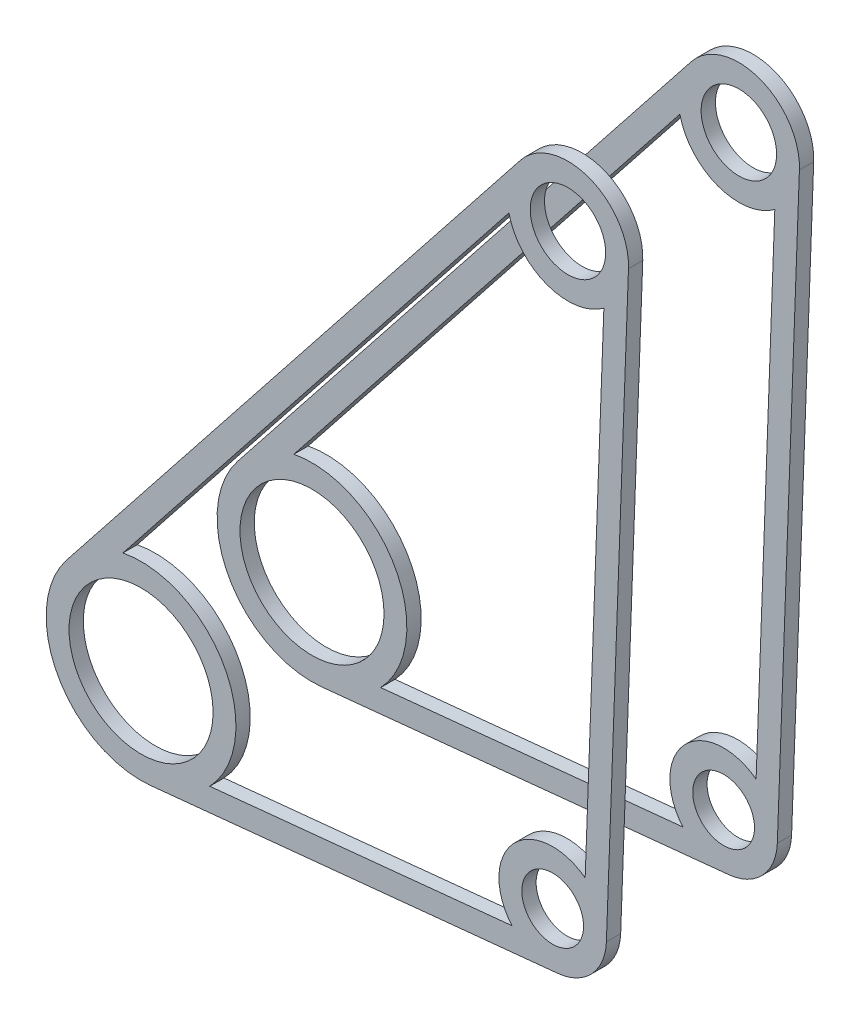
from build123d import *

# Parameters (mm, degrees)
BOSS_EXTRUDE1_START = 8.6995
SKETCH1_R           = 8.001
SKETCH1_R_2         = 4.191
SKETCH1_R_3         = 3.429
BOSS_EXTRUDE1_DEPTH = 1.5875
BOSS_EXTRUDE2_START = -8.6995
SKETCH1_4_R         = 8.001
SKETCH1_4_R_2       = 4.191
SKETCH1_4_R_3       = 3.429
BOSS_EXTRUDE2_DEPTH = 1.5875


with BuildPart() as part:
    # Sketch1 → Boss-Extrude1 (new body)
    with BuildSketch(Plane.XY.offset(BOSS_EXTRUDE1_START)):
        with BuildLine():
            ThreePointArc((-8.264104742, 6.543489422), (-9.247450164, -5.059382025), (1.0541, -10.488162575))
            Line((1.0541, -10.488162575), (46.3169, -5.939080012))
            ThreePointArc((46.3169, -5.939080012), (50.071526337, -4.085728764), (51.684874278, -0.221891526))
            Line((51.684874278, -0.221891526), (54.139680923, 65.768068925))
            ThreePointArc((54.139680923, 65.768068925), (49.743182937, 72.33320285), (42.136254402, 70.196659792))
            Line((42.136254402, 70.196659792), (-8.264104742, 6.543489422))
        make_face()
        Circle(SKETCH1_R, mode=Mode.SUBTRACT)
        with BuildLine():
            Line((-2.01262532, 10.347077864), (40.857998083, 64.490562984))
            ThreePointArc((40.857998083, 64.490562984), (45.083483729, 59.703371208), (51.405639077, 60.599075292))
            Line((51.405639077, 60.599075292), (49.328254105, 4.754940937))
            ThreePointArc((49.328254105, 4.754940937), (41.368473663, 4.085728764), (41.201602766, -3.900390677))
            Line((41.201602766, -3.900390677), (7.628402366, -7.274624275))
            ThreePointArc((7.628402366, -7.274624275), (9.247450164, 5.059382025), (-2.01262532, 10.347077864))
        make_face(mode=Mode.SUBTRACT)
        with Locations((47.413333333, 66.018287029)):
            Circle(SKETCH1_R_2, mode=Mode.SUBTRACT)
        with Locations((45.72, 0)):
            Circle(SKETCH1_R_3, mode=Mode.SUBTRACT)
    extrude(amount=BOSS_EXTRUDE1_DEPTH)


with BuildPart() as body_2:
    # Sketch1<4> → Boss-Extrude2 (new body)
    with BuildSketch(Plane.XY.offset(BOSS_EXTRUDE2_START)):
        with BuildLine():
            ThreePointArc((-8.264104742, 6.543489422), (-9.247450164, -5.059382025), (1.0541, -10.488162575))
            Line((1.0541, -10.488162575), (46.3169, -5.939080012))
            ThreePointArc((46.3169, -5.939080012), (50.071526337, -4.085728764), (51.684874278, -0.221891526))
            Line((51.684874278, -0.221891526), (54.139680923, 65.768068925))
            ThreePointArc((54.139680923, 65.768068925), (49.743182937, 72.33320285), (42.136254402, 70.196659792))
            Line((42.136254402, 70.196659792), (-8.264104742, 6.543489422))
        make_face()
        Circle(SKETCH1_4_R, mode=Mode.SUBTRACT)
        with BuildLine():
            Line((-2.01262532, 10.347077864), (40.857998083, 64.490562984))
            ThreePointArc((40.857998083, 64.490562984), (45.083483729, 59.703371208), (51.405639077, 60.599075292))
            Line((51.405639077, 60.599075292), (49.328254105, 4.754940937))
            ThreePointArc((49.328254105, 4.754940937), (41.368473663, 4.085728764), (41.201602766, -3.900390677))
            Line((41.201602766, -3.900390677), (7.628402366, -7.274624275))
            ThreePointArc((7.628402366, -7.274624275), (9.247450164, 5.059382025), (-2.01262532, 10.347077864))
        make_face(mode=Mode.SUBTRACT)
        with Locations((47.413333333, 66.018287029)):
            Circle(SKETCH1_4_R_2, mode=Mode.SUBTRACT)
        with Locations((45.72, 0)):
            Circle(SKETCH1_4_R_3, mode=Mode.SUBTRACT)
    extrude(amount=-BOSS_EXTRUDE2_DEPTH)


solid = Compound([part.part, body_2.part])
